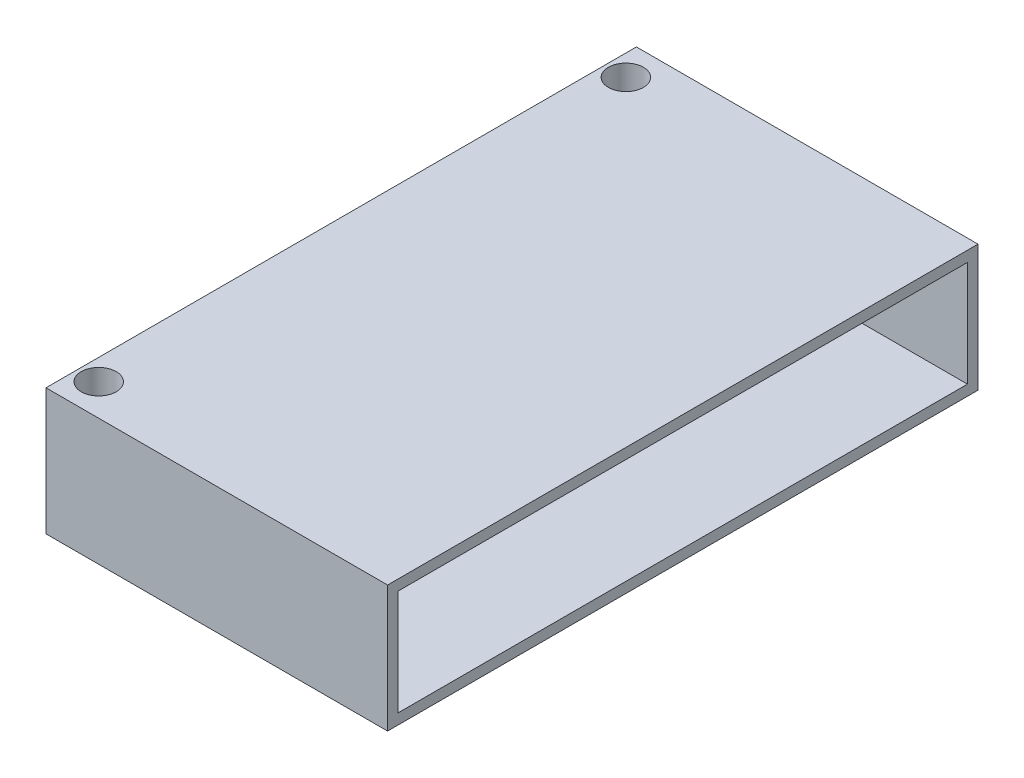
from build123d import *

# Parameters (mm, degrees)
SKETCH1_W           = 81
SKETCH1_H           = 140
BOSS_EXTRUDE2_DEPTH = 30
SKETCH3_R           = 4.15
CUT_EXTRUDE2_DEPTH  = 7
SHELL1_START        = 2.5
SHELL1_DEPTH        = 25
SHELL1_2_DEPTH      = 18


# Read off the part's stored shape, not the designer's step: Shell1
with BuildPart() as part:
    # Sketch1 → Boss-Extrude2 (new body)
    with BuildSketch(Plane(origin=(0, 0, 0), x_dir=(1, 0, 0), z_dir=(0, 1, 0))):
        with Locations((-39.5, 70)):
            Rectangle(SKETCH1_W, SKETCH1_H)
    extrude(amount=BOSS_EXTRUDE2_DEPTH)

    # Sketch3 → Cut-Extrude2 (cut)
    with BuildSketch(Plane(origin=(0, 30, 0), x_dir=(1, 0, 0), z_dir=(0, 1, 0))):
        with Locations(Location((-75, 7.5, 0), (0, 0, 270))):
            Circle(SKETCH3_R)
        with Locations(Location((-75, 132.5, 0), (0, 0, 270))):
            Circle(SKETCH3_R)
    extrude(amount=-CUT_EXTRUDE2_DEPTH, mode=Mode.SUBTRACT)

    # Shell1 outline → Shell1 (cut)
    with BuildSketch(Plane(origin=(0, 0, 0), x_dir=(1, 0, 0), z_dir=(0, 1, 0)).offset(SHELL1_START)):
        with BuildLine():
            Line((1, 137.5), (-70.615652842, 137.5))
            ThreePointArc((-70.615652842, 137.5), (-69.339940487, 129.009122415), (-77.5, 126.337816945))
            Line((-77.5, 126.337816945), (-77.5, 13.662183055))
            ThreePointArc((-77.5, 13.662183055), (-69.339940487, 10.990877585), (-70.615652842, 2.5))
            Line((-70.615652842, 2.5), (1, 2.5))
            Line((1, 2.5), (1, 137.5))
        make_face()
    extrude(amount=SHELL1_DEPTH, mode=Mode.SUBTRACT)

    # Shell1 2 outline → Shell1 2 (cut)
    with BuildSketch(Plane(origin=(0, 0, 0), x_dir=(1, 0, 0), z_dir=(0, 1, 0)).offset(SHELL1_START)):
        with BuildLine():
            Line((-70.615652842, 137.5), (-77.5, 137.5))
            Line((-77.5, 137.5), (-77.5, 126.337816945))
            ThreePointArc((-77.5, 126.337816945), (-69.339940487, 129.009122415), (-70.615652842, 137.5))
        make_face()
        with BuildLine():
            ThreePointArc((-70.615652842, 2.5), (-69.339940487, 10.990877585), (-77.5, 13.662183055))
            Line((-77.5, 13.662183055), (-77.5, 2.5))
            Line((-77.5, 2.5), (-70.615652842, 2.5))
        make_face()
    extrude(amount=SHELL1_2_DEPTH, mode=Mode.SUBTRACT)


solid = part.part
